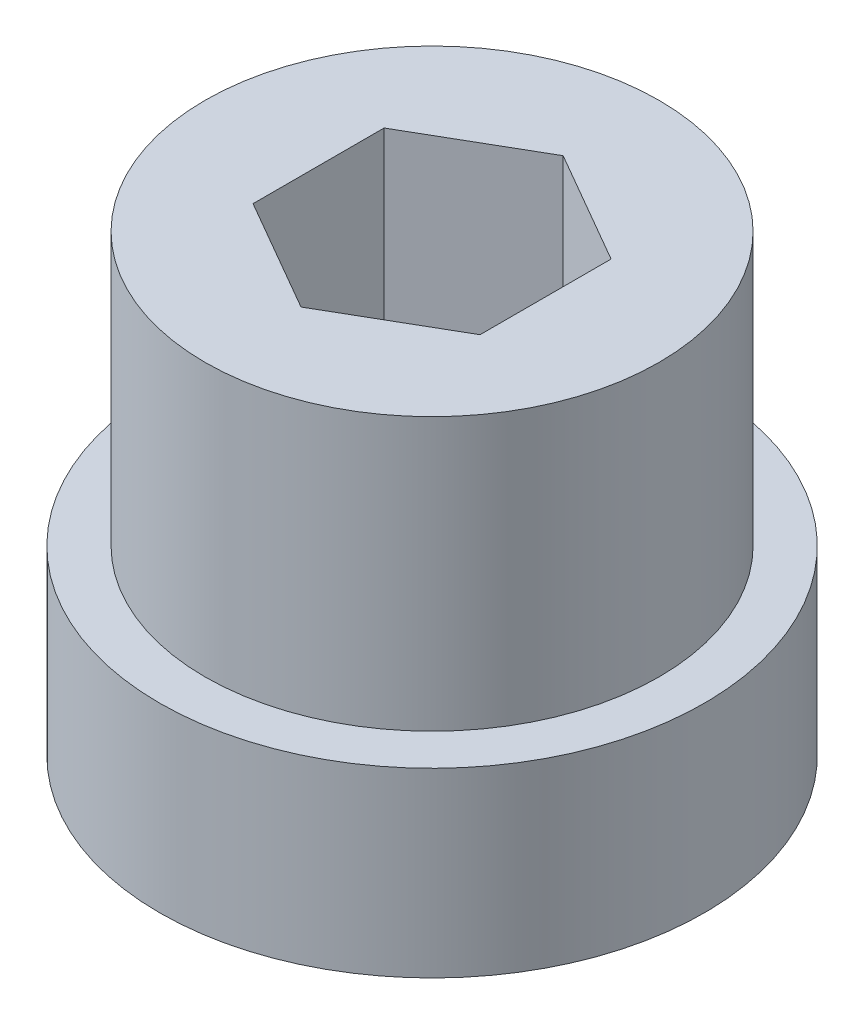
from build123d import *

# Parameters (mm, degrees)
SKETCH1_R           = 7
BOSS_EXTRUDE1_DEPTH = 4
SKETCH2_R           = 5
BOSS_EXTRUDE2_DEPTH = 6
CUT_EXTRUDE2_DEPTH  = 15.071247279
SKETCH5_OUTSIDE_W   = 20.436
SKETCH5_OUTSIDE_H   = 20.436
SKETCH5_OUTSIDE_R   = 6
CUT_EXTRUDE3_DEPTH  = 12.575836903


with BuildPart() as part:
    # Sketch1 → Boss-Extrude1 (new body)
    with BuildSketch(Plane(origin=(0, 0, 0), x_dir=(1, 0, 0), z_dir=(0, 1, 0))):
        Circle(SKETCH1_R)
    extrude(amount=BOSS_EXTRUDE1_DEPTH)

    # Sketch2 → Boss-Extrude2 (add)
    with BuildSketch(Plane(origin=(0, 4, 0), x_dir=(1, 0, 0), z_dir=(0, 1, 0))):
        Circle(SKETCH2_R)
    extrude(amount=BOSS_EXTRUDE2_DEPTH)

    # Sketch4 → Cut-Extrude2 (cut, through all)
    with BuildSketch(Plane(origin=(0, 10, 0), x_dir=(1, 0, 0), z_dir=(0, 1, 0))):
        Polygon((2.5, 1.443375673), (0, 2.886751346), (-2.5, 1.443375673), (-2.5, -1.443375673), (0, -2.886751346), (2.5, -1.443375673), align=None)
    extrude(amount=-CUT_EXTRUDE2_DEPTH, mode=Mode.SUBTRACT)

    # Sketch5 outside → Cut-Extrude3 (cut, through all)
    with BuildSketch(Plane(origin=(0, 4, 0), x_dir=(1, 0, 0), z_dir=(0, 1, 0))):
        Rectangle(SKETCH5_OUTSIDE_W, SKETCH5_OUTSIDE_H)
        Circle(SKETCH5_OUTSIDE_R, mode=Mode.SUBTRACT)
    extrude(amount=-CUT_EXTRUDE3_DEPTH, mode=Mode.SUBTRACT)


solid = part.part
